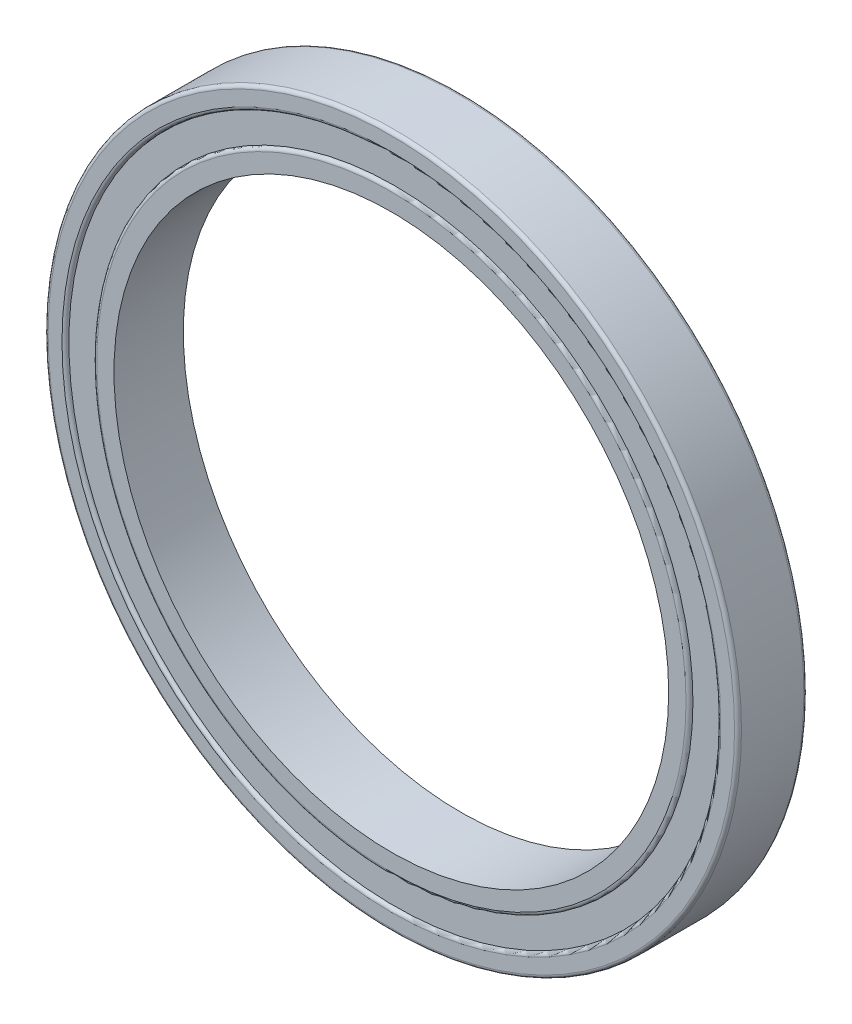
from build123d import *

# Parameters (mm, degrees)
SKETCH1_R           = 50
SKETCH1_R_2         = 40
BOSS_EXTRUDE1_DEPTH = 10
SKETCH2_R           = 47
SKETCH2_R_2         = 43
CUT_EXTRUDE1_DEPTH  = 0.5
CUT_EXTRUDE2_START  = -0.5
SKETCH3_R           = 47
SKETCH3_R_2         = 43
CUT_EXTRUDE2_DEPTH  = 0.5
FILLET1_R           = 0.5


with BuildPart() as part:
    # Sketch1 → Boss-Extrude1 (new body)
    with BuildSketch(Plane.XY):
        Circle(SKETCH1_R)
        Circle(SKETCH1_R_2, mode=Mode.SUBTRACT)
    extrude(amount=BOSS_EXTRUDE1_DEPTH)

    # Sketch2 → Cut-Extrude1 (cut)
    with BuildSketch(Plane.XY.offset(10)):
        Circle(SKETCH2_R)
        Circle(SKETCH2_R_2, mode=Mode.SUBTRACT)
    extrude(amount=-CUT_EXTRUDE1_DEPTH, mode=Mode.SUBTRACT)

    # Sketch3 → Cut-Extrude2 (cut)
    with BuildSketch(Plane(origin=(0, 0, 0), x_dir=(-1, 0, 0), z_dir=(0, 0, -1)).offset(CUT_EXTRUDE2_START)):
        with Locations(Location((0, 0, 0), (0, 0, 180))):
            Circle(SKETCH3_R)
        with Locations(Location((0, 0, 0), (0, 0, 180))):
            Circle(SKETCH3_R_2, mode=Mode.SUBTRACT)
    extrude(amount=CUT_EXTRUDE2_DEPTH, mode=Mode.SUBTRACT)

    # Fillet1
    fillet1_edges = [part.edges().sort_by_distance(p)[0] for p in [
        (-47, 0, 10),
        (-43, 0, 10),
        (-47, 0, 0),
        (-50, 0, 0),
        (-43, 0, 0),
        (-50, 0, 10),
    ]]
    fillet(fillet1_edges, radius=FILLET1_R - 0.0001)  # a hair under: the kernel refuses the full size


solid = part.part
